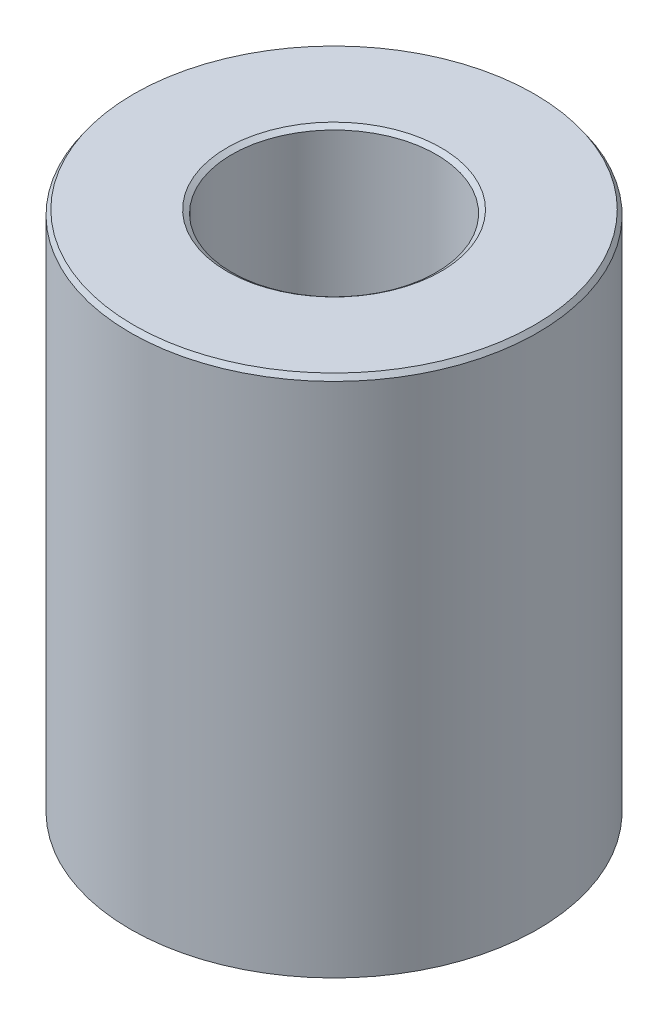
from build123d import *
from OCP.BRepFilletAPI import BRepFilletAPI_MakeChamfer

# Parameters (mm, degrees)
SKETCH1_R           = 42.5
BOSS_EXTRUDE1_DEPTH = 109.52488038
SKETCH2_R           = 21.330402007
CUT_EXTRUDE1_DEPTH  = 125.932779615
CHAMFER1_SIZE       = 1.016330978
CHAMFER1_SIZE2      = 0.708426405


with BuildPart() as part:
    # Sketch1 → Boss-Extrude1 (new body)
    with BuildSketch(Plane(origin=(0, 0, 0), x_dir=(1, 0, 0), z_dir=(0, 1, 0))):
        Circle(SKETCH1_R)
    extrude(amount=BOSS_EXTRUDE1_DEPTH)

    # Sketch2 → Cut-Extrude1 (cut, through all)
    with BuildSketch(Plane(origin=(0, 0, 0), x_dir=(1, 0, 0), z_dir=(0, 1, 0))):
        Circle(SKETCH2_R)
    extrude(amount=CUT_EXTRUDE1_DEPTH, mode=Mode.SUBTRACT)

    # Chamfer1: one chamfer whose edges measure the first distance from different faces: ONE call of the kernel's chamfer builder (chamfer() names one face for all edges)
    chamfer1_edges_1 = [part.edges().sort_by_distance(p)[0] for p in [
        (-21.330402007, 109.52488038, 0),
    ]]
    chamfer1_side_1 = [part.faces().sort_by_distance(p)[0] for p in [
        (-41.297918472, 109.52488038, 0),
    ]]
    chamfer1_edges_2 = [part.edges().sort_by_distance(p)[0] for p in [
        (-21.330402007, 0, 0),
    ]]
    chamfer1_side_2 = [part.faces().sort_by_distance(p)[0] for p in [
        (-21.330402007, 54.76244019, 0),
    ]]
    chamfer1_edges_3 = [part.edges().sort_by_distance(p)[0] for p in [
        (-42.5, 0, 0),
    ]]
    chamfer1_side_3 = [part.faces().sort_by_distance(p)[0] for p in [
        (-41.297918472, 0, 0),
    ]]
    chamfer1_edges_4 = [part.edges().sort_by_distance(p)[0] for p in [
        (-42.5, 109.52488038, 0),
    ]]
    chamfer1_side_4 = [part.faces().sort_by_distance(p)[0] for p in [
        (-42.5, 54.76244019, 0),
    ]]
    chamfer1 = BRepFilletAPI_MakeChamfer(part.part.solid().wrapped)
    for e in chamfer1_edges_1:
        chamfer1.Add(CHAMFER1_SIZE, CHAMFER1_SIZE2, e.wrapped, chamfer1_side_1[0].wrapped)  # the first distance lies on this face
    for e in chamfer1_edges_2:
        chamfer1.Add(CHAMFER1_SIZE, CHAMFER1_SIZE2, e.wrapped, chamfer1_side_2[0].wrapped)  # the first distance lies on this face
    for e in chamfer1_edges_3:
        chamfer1.Add(CHAMFER1_SIZE, CHAMFER1_SIZE2, e.wrapped, chamfer1_side_3[0].wrapped)  # the first distance lies on this face
    for e in chamfer1_edges_4:
        chamfer1.Add(CHAMFER1_SIZE, CHAMFER1_SIZE2, e.wrapped, chamfer1_side_4[0].wrapped)  # the first distance lies on this face
    add(Compound.cast(chamfer1.Shape()), mode=Mode.REPLACE)


solid = part.part
